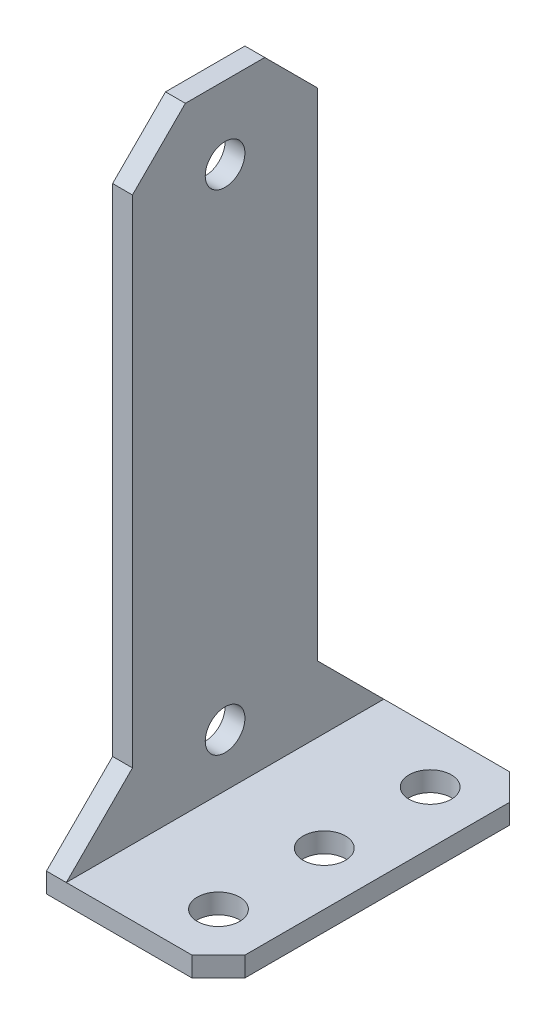
from build123d import *

# Parameters (mm, degrees)
EXTRUDE_1_DEPTH     = 12
SKETCH_2_R          = 1.6
CUT_EXTRUDE_1_DEPTH = 45.2
CHAMFER_1_SIZE      = 2
SKETCH_4_R          = 1.5
CUT_EXTRUDE_2_DEPTH = 52.15662225
SKETCH_6_W          = 26.1795091
SKETCH_6_H          = 41
CUT_EXTRUDE_3_DEPTH = 10
CHAMFER_2_SIZE      = 4
CHAMFER_4_SIZE      = 5


with BuildPart() as part:
    # Эскиз1 → Бобышка-Вытянуть1 (new, symmetric)
    with BuildSketch(Plane.XY):
        Polygon((0, 0), (0, 48), (1.5, 48), (1.5, 1.5), (13, 1.5), (13, 0), align=None)
    extrude(amount=EXTRUDE_1_DEPTH, both=True)

    # Эскиз2 → Вырез-Вытянуть1 (cut)
    with BuildSketch(Plane(origin=(0, 1.5, 0), x_dir=(1, 0, 0), z_dir=(0, 1, 0))):
        with Locations(Location((9, 0, 0), (0, 0, 270))):
            Circle(SKETCH_2_R)
        with Locations(Location((9, -8, 0), (0, 0, 270))):
            Circle(SKETCH_2_R)
        with Locations(Location((9, 8, 0), (0, 0, 270))):
            Circle(SKETCH_2_R)
    extrude(amount=-CUT_EXTRUDE_1_DEPTH, mode=Mode.SUBTRACT)

    # Фаска1
    chamfer_1_edges = [part.edges().sort_by_distance(p)[0] for p in [
        (13, 0.75, 12),
        (13, 0.75, -12),
    ]]
    chamfer(chamfer_1_edges, length=CHAMFER_1_SIZE)

    # Эскиз4 → Вырез-Вытянуть2 (cut, through all)
    with BuildSketch(Plane.ZY):
        with Locations((0, 42.5)):
            Circle(SKETCH_4_R)
        with Locations((0, 5.5)):
            Circle(SKETCH_4_R)
    extrude(amount=-CUT_EXTRUDE_2_DEPTH, mode=Mode.SUBTRACT)

    # Эскиз6 → Вырез-Вытянуть3 (cut)
    with BuildSketch(Plane.ZY):
        Polygon((7, 72.5), (7, 42.5), (33.1795091, 42.5), (33.38840833, 42.5), (33.38840833, 72.5), align=None)
        with Locations((20.08975455, 22)):
            Rectangle(SKETCH_6_W, SKETCH_6_H)
        with Locations((-20.08975455, 22)):
            Rectangle(SKETCH_6_W, SKETCH_6_H)
        Polygon((-33.38840833, 42.5), (-33.1795091, 42.5), (-7, 42.5), (-7, 72.5), (-33.38840833, 72.5), align=None)
    extrude(amount=-CUT_EXTRUDE_3_DEPTH, mode=Mode.SUBTRACT)

    # Фаска2
    chamfer_2_edges = [part.edges().sort_by_distance(p)[0] for p in [
        (0.75, 48, -7),
        (0.75, 48, 7),
    ]]
    chamfer(chamfer_2_edges, length=CHAMFER_2_SIZE)

    # Фаска4
    chamfer_4_edges = [part.edges().sort_by_distance(p)[0] for p in [
        (0.75, 1.5, 7),
        (0.75, 1.5, -7),
    ]]
    chamfer(chamfer_4_edges, length=CHAMFER_4_SIZE - 0.0001)  # a hair under: the kernel refuses the full size


solid = part.part
